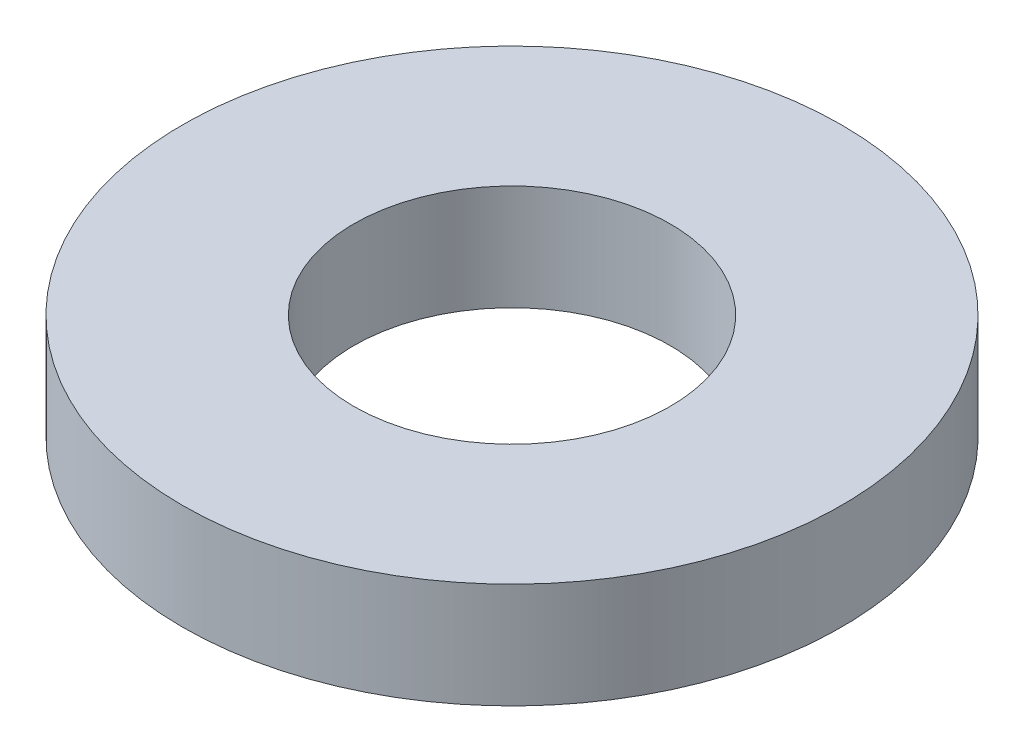
from build123d import *

# Parameters (mm, degrees)
SKETCH1_R           = 62.5
BOSS_EXTRUDE1_DEPTH = 20
SKETCH2_R           = 30
CUT_EXTRUDE1_DEPTH  = 91.622844802


with BuildPart() as part:
    # Sketch1 → Boss-Extrude1 (new body)
    with BuildSketch(Plane(origin=(0, 0, 0), x_dir=(1, 0, 0), z_dir=(0, 1, 0))):
        Circle(SKETCH1_R)
    extrude(amount=BOSS_EXTRUDE1_DEPTH)

    # Sketch2 → Cut-Extrude1 (cut, through all)
    with BuildSketch(Plane(origin=(0, 0, 0), x_dir=(1, 0, 0), z_dir=(0, 1, 0))):
        Circle(SKETCH2_R)
    extrude(amount=CUT_EXTRUDE1_DEPTH, mode=Mode.SUBTRACT)


solid = part.part
